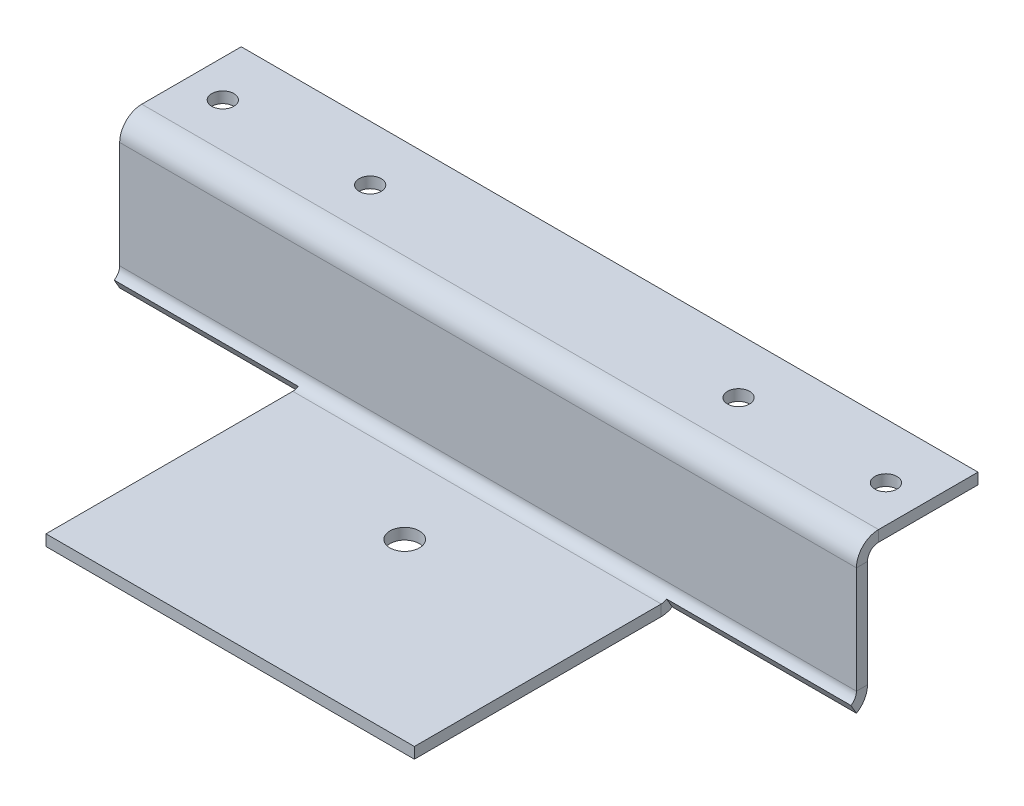
from build123d import *

# Parameters (mm, degrees)
SKETCH9_W                    = 200
SKETCH9_H                    = 30
BASE_FLANGE2_DEPTH           = 3
EDGE_FLANGE1_STRIP_W         = 18
EDGE_FLANGE1_STRIP_H         = 3
EDGE_FLANGE1_STRIP_CUT_DEPTH = 200
EDGE_FLANGE1_DEPTH           = 200
EDGE_FLANGE2_STRIP_W         = 18
EDGE_FLANGE2_STRIP_H         = 3
EDGE_FLANGE2_STRIP_CUT_DEPTH = 200
EDGE_FLANGE2_DEPTH           = 200
CUT_EXTRUDE1_START           = -3
CUT_EXTRUDE1_OUTLINE_R       = 4
CUT_EXTRUDE1_DEPTH           = 3
CUT_EXTRUDE1_START_2         = -100
CUT_EXTRUDE1_2_DEPTH         = 50
CUT_EXTRUDE1_START_3         = 50
CUT_EXTRUDE1_3_DEPTH         = 50
SKETCH19_R                   = 3
CUT_EXTRUDE2_DEPTH           = 3


# Read off the part's stored shape, not the designer's step: Cut-Extrude1
# Sheet-metal steps are written as plain solids
with BuildPart() as part:
    # Sketch9 → Base-Flange2 (new body)
    with BuildSketch(Plane(origin=(0, 0, 0), x_dir=(1, 0, 0), z_dir=(0, 1, 0))):
        with Locations((0, 15)):
            Rectangle(SKETCH9_W, SKETCH9_H)
    extrude(amount=-BASE_FLANGE2_DEPTH)

    # Edge-Flange1 strip (across the edge) → Edge-Flange1 strip cut (cut)
    with BuildSketch(Plane(origin=(100, -3, 0), x_dir=(0, 0, -1), z_dir=(-1, 0, 0))):
        with Locations((-6, -1.5)):
            Rectangle(EDGE_FLANGE1_STRIP_W, EDGE_FLANGE1_STRIP_H)
    extrude(amount=EDGE_FLANGE1_STRIP_CUT_DEPTH, mode=Mode.SUBTRACT)

    # Edge-Flange1 section (across the edge) → Edge-Flange1 (add)
    with BuildSketch(Plane(origin=(100, -3, 0), x_dir=(0, 0, -1), z_dir=(-1, 0, 0))):
        with BuildLine():
            Line((-3, 3), (-3, 35))
            Line((-3, 35), (0, 35))
            Line((0, 35), (0, 3))
            ThreePointArc((0, 3), (0.878679656, 0.878679656), (3, 0))
            Line((3, 0), (3, -3))
            ThreePointArc((3, -3), (-1.242640687, -1.242640687), (-3, 3))
        make_face()
    extrude(amount=EDGE_FLANGE1_DEPTH)

    # Edge-Flange2 strip (across the edge) → Edge-Flange2 strip cut (cut)
    with BuildSketch(Plane(origin=(-100, -38, 3), x_dir=(0, 1, 0), z_dir=(1, 0, 0))):
        with Locations((-6, -1.5)):
            Rectangle(EDGE_FLANGE2_STRIP_W, EDGE_FLANGE2_STRIP_H)
    extrude(amount=EDGE_FLANGE2_STRIP_CUT_DEPTH, mode=Mode.SUBTRACT)

    # Edge-Flange2 section (across the edge) → Edge-Flange2 (add)
    with BuildSketch(Plane(origin=(-100, -38, 3), x_dir=(0, 1, 0), z_dir=(1, 0, 0))):
        with BuildLine():
            Line((-3, 3), (-3, 70))
            Line((-3, 70), (0, 70))
            Line((0, 70), (0, 3))
            ThreePointArc((0, 3), (0.878679656, 0.878679656), (3, 0))
            Line((3, 0), (3, -3))
            ThreePointArc((3, -3), (-1.242640687, -1.242640687), (-3, 3))
        make_face()
    extrude(amount=EDGE_FLANGE2_DEPTH)

    # Cut-Extrude1 outline → Cut-Extrude1 (cut)
    with BuildSketch(Plane(origin=(0, -38, 0), x_dir=(1, 0, 0), z_dir=(0, 1, 0)).offset(CUT_EXTRUDE1_START)):
        with Locations((0, -25.63)):
            Circle(CUT_EXTRUDE1_OUTLINE_R)
    extrude(amount=CUT_EXTRUDE1_DEPTH, mode=Mode.SUBTRACT)

    # Cut-Extrude1 2 outline → Cut-Extrude1 2 (cut)
    with BuildSketch(Plane.YZ.offset(CUT_EXTRUDE1_START_2)):
        with BuildLine():
            ThreePointArc((-41, 6), (-40.795554958, 4.447085729), (-40.196152423, 3))
            Line((-40.196152423, 3), (-37.598076212, 4.5))
            ThreePointArc((-37.598076212, 4.5), (-37.897777479, 5.223542864), (-38, 6))
            Line((-38, 6), (-38, 73))
            Line((-38, 73), (-41, 73))
            Line((-41, 73), (-41, 6))
        make_face()
    extrude(amount=CUT_EXTRUDE1_2_DEPTH, mode=Mode.SUBTRACT)

    # Cut-Extrude1 3 outline → Cut-Extrude1 3 (cut)
    with BuildSketch(Plane.YZ.offset(CUT_EXTRUDE1_START_3)):
        with BuildLine():
            ThreePointArc((-41, 6), (-40.795554958, 4.447085729), (-40.196152423, 3))
            Line((-40.196152423, 3), (-37.598076212, 4.5))
            ThreePointArc((-37.598076212, 4.5), (-37.897777479, 5.223542864), (-38, 6))
            Line((-38, 6), (-38, 73))
            Line((-38, 73), (-41, 73))
            Line((-41, 73), (-41, 6))
        make_face()
    extrude(amount=CUT_EXTRUDE1_3_DEPTH, mode=Mode.SUBTRACT)

    # Sketch19 → Cut-Extrude2 (cut)
    with BuildSketch(Plane(origin=(0, 0, 0), x_dir=(1, 0, 0), z_dir=(0, 1, 0))):
        with Locations(Location((-90, 15, 0), (0, 0, 270))):
            Circle(SKETCH19_R)
        with Locations(Location((-50, 15, 0), (0, 0, 270))):
            Circle(SKETCH19_R)
        with Locations(Location((50, 15, 0), (0, 0, 270))):
            Circle(SKETCH19_R)
        with Locations(Location((90, 15, 0), (0, 0, 270))):
            Circle(SKETCH19_R)
    extrude(amount=-CUT_EXTRUDE2_DEPTH, mode=Mode.SUBTRACT)


solid = part.part
